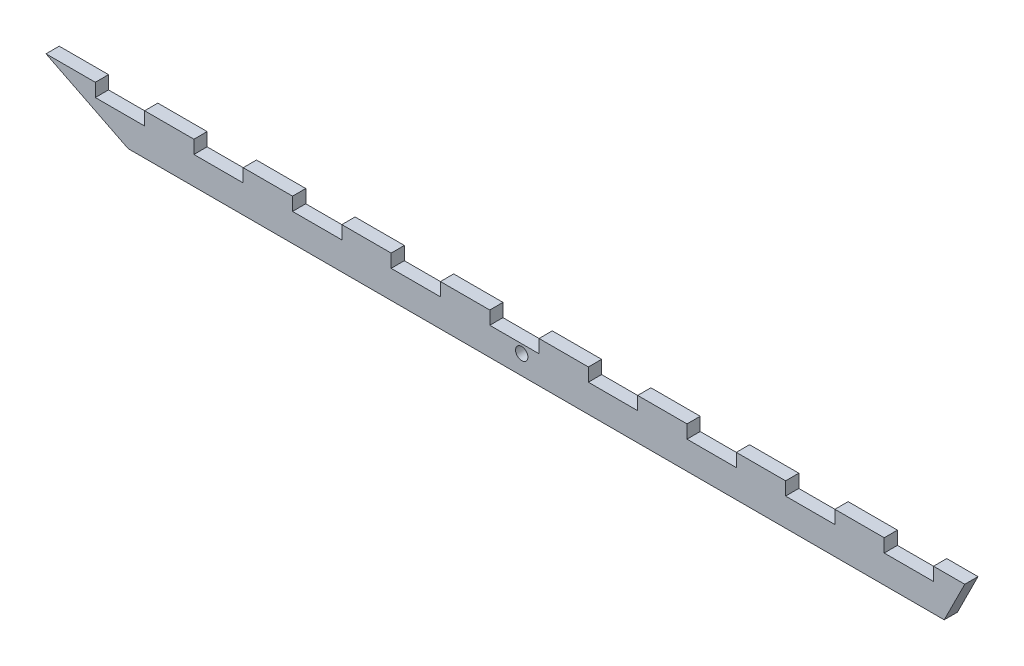
from build123d import *

# Parameters (mm, degrees)
SKETCH1_R           = 1.5
BOSS_EXTRUDE1_DEPTH = 1.61
CUT_EXTRUDE1_REACH  = 117.941
SKETCH2_W           = 12
SKETCH2_H           = 3.22
LPATTERN1_COUNT     = 9
LPATTERN1_PITCH     = 24


with BuildPart() as part:
    # Sketch1 → Boss-Extrude1 (new, symmetric)
    with BuildSketch(Plane.XY):
        Polygon((-95.775442885, -4.703941319), (-115.775442885, 5.296058681), (107.831354865, 5.296058681), (102.831354865, -4.703941319), align=None)
        Circle(SKETCH1_R, mode=Mode.SUBTRACT)
    extrude(amount=BOSS_EXTRUDE1_DEPTH, both=True)

    # Sketch2 → Cut-Extrude1 (cut, up to next)
    with BuildSketch(Plane.XY.offset(1.61), mode=Mode.PRIVATE) as cut_extrude1_sk1:
        with Locations((-97.775442885, 3.686058681)):
            Rectangle(SKETCH2_W, SKETCH2_H)
    cut_extrude1_tool1 = extrude(cut_extrude1_sk1.sketch, amount=-CUT_EXTRUDE1_REACH, mode=Mode.PRIVATE) & part.part
    cut_extrude1 = cut_extrude1_tool1.solids().sort_by_distance((-97.775443, 3.686059, 1.61))[0]
    add(cut_extrude1, mode=Mode.SUBTRACT)

    # LPattern1: Cut-Extrude1 ×9
    with Locations(*[(i * LPATTERN1_PITCH, 0, 0) for i in range(1, LPATTERN1_COUNT)]):
        add(cut_extrude1, mode=Mode.SUBTRACT)


solid = part.part
